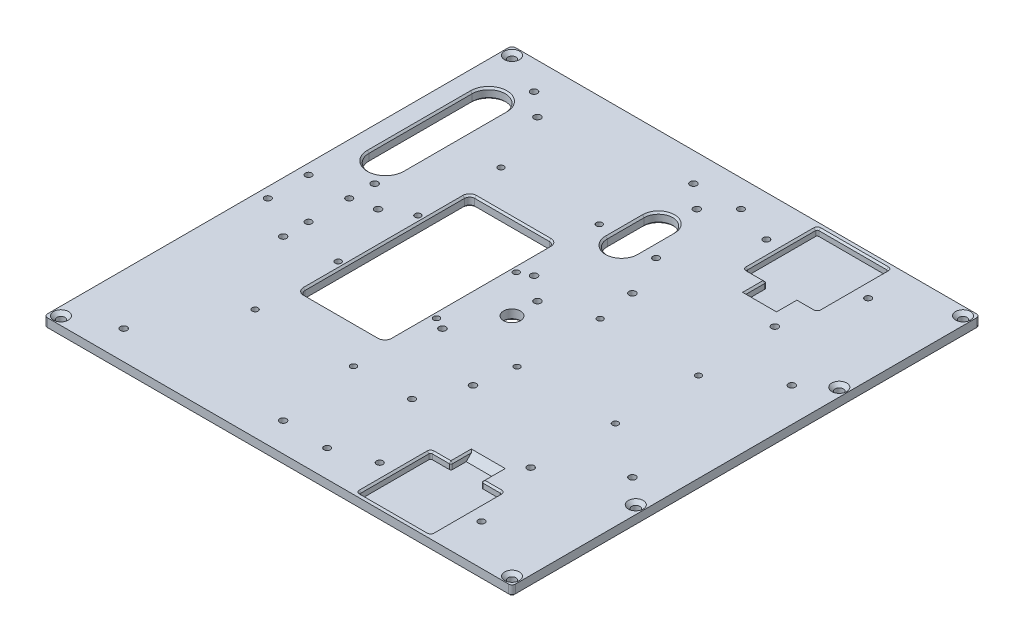
from build123d import *

# Parameters (mm, degrees)
SKETCH_1_W              = 276
SKETCH_1_H              = 276
EXTRUDE_1_DEPTH         = 6
FILLET_1_R              = 2
SKETCH_2_R              = 2.4
CUT_EXTRUDE_1_DEPTH     = 6
SKETCH_10_R             = 1.9
SKETCH_10_R_2           = 2
CUT_EXTRUDE_2259_DEPTH  = 7
SKETCH_4_R              = 2
CUT_EXTRUDE_94_94_DEPTH = 6
SKETCH_8_R              = 1.75
RPI4_DEPTH              = 6
SKETCH_6_R              = 5
SKETCH_6_W              = 50
SKETCH_6_H              = 100
CUT_EXTRUDE_5_DEPTH     = 6
CUT_EXTRUDE_14_DEPTH    = 4
CHAMFER_1_SIZE          = 4
SKETCH_12_R             = 1.9
CUT_EXTRUDE_15_DEPTH    = 196.253681143
FILLET_2_R              = 1
FILLET_3_R              = 3
CHAMFER_2_SIZE          = 2
CHAMFER_3_SIZE          = 1
CHAMFER_4_SIZE          = 1
CHAMFER_5_SIZE          = 1


with BuildPart() as part:
    # Эскиз1 → Бобышка-Вытянуть1 (new body)
    with BuildSketch(Plane(origin=(0, 0, 0), x_dir=(1, 0, 0), z_dir=(0, 1, 0))):
        Rectangle(SKETCH_1_W, SKETCH_1_H)
    extrude(amount=EXTRUDE_1_DEPTH)

    # Скругление1
    fillet_1_edges = [part.edges().sort_by_distance(p)[0] for p in [
        (138, 3, 138),
        (-138, 3, 138),
        (-138, 3, -138),
        (138, 3, -138),
    ]]
    fillet(fillet_1_edges, radius=FILLET_1_R)

    # Эскиз2 → Вырез-Вытянуть1 (cut)
    with BuildSketch(Plane(origin=(0, 6, 0), x_dir=(1, 0, 0), z_dir=(0, 1, 0))):
        with Locations(Location((133, 60, 0), (0, 0, 90))):
            Circle(SKETCH_2_R)
        with Locations(Location((133, -60, 0), (0, 0, 270))):
            Circle(SKETCH_2_R)
        with Locations(Location((133, 133, 0), (0, 0, 270))):
            Circle(SKETCH_2_R)
        with Locations(Location((133, -133, 0), (0, 0, 90))):
            Circle(SKETCH_2_R)
        with Locations(Location((-133, -133, 0), (0, 0, 270))):
            Circle(SKETCH_2_R)
        with Locations(Location((-133, 133, 0), (0, 0, 90))):
            Circle(SKETCH_2_R)
    extrude(amount=-CUT_EXTRUDE_1_DEPTH, mode=Mode.SUBTRACT)

    # Эскиз10 → Cut-Extrude 2259 (cut)
    with BuildSketch(Plane(origin=(0, 6, 0), x_dir=(1, 0, 0), z_dir=(0, 1, 0))):
        with Locations(Location((13, 122, 0), (0, 0, 270))):
            Circle(SKETCH_10_R)
        with Locations(Location((13, 72, 0), (0, 0, 90))):
            Circle(SKETCH_10_R)
        with Locations(Location((83, 72, 0), (0, 0, 270))):
            Circle(SKETCH_10_R_2)
        with Locations(Location((-132, 12, 0), (0, 0, 270))):
            Circle(SKETCH_10_R)
        with Locations(Location((-108, 12, 0), (0, 0, 270))):
            Circle(SKETCH_10_R)
        with Locations(Location((-108, -12, 0), (0, 0, 270))):
            Circle(SKETCH_10_R)
        with Locations(Location((-132, -12, 0), (0, 0, 270))):
            Circle(SKETCH_10_R)
        with Locations(Location((83, -72, 0), (0, 0, 90))):
            Circle(SKETCH_10_R_2)
        with Locations(Location((13, -72, 0), (0, 0, 270))):
            Circle(SKETCH_10_R)
        with Locations(Location((13, -122, 0), (0, 0, 90))):
            Circle(SKETCH_10_R)
    extrude(amount=-CUT_EXTRUDE_2259_DEPTH, mode=Mode.SUBTRACT)

    # Эскиз4 → 94х94 (cut)
    with BuildSketch(Plane(origin=(0, 6, 0), x_dir=(1, 0, 0), z_dir=(0, 1, 0))):
        with Locations(Location((-108, 121, 0), (0, 0, 270))):
            Circle(SKETCH_4_R)
        with Locations(Location((-14, 121, 0), (0, 0, 270))):
            Circle(SKETCH_4_R)
        with Locations(Location((-14, 27, 0), (0, 0, 90))):
            Circle(SKETCH_4_R)
        with Locations(Location((-108, 27, 0), (0, 0, 90))):
            Circle(SKETCH_4_R)
        with Locations(Location((-108, -27, 0), (0, 0, 270))):
            Circle(SKETCH_4_R)
        with Locations(Location((-14, -27, 0), (0, 0, 270))):
            Circle(SKETCH_4_R)
        with Locations(Location((-14, -121, 0), (0, 0, 90))):
            Circle(SKETCH_4_R)
        with Locations(Location((-108, -121, 0), (0, 0, 90))):
            Circle(SKETCH_4_R)
        with Locations(Location((24, 47, 0), (0, 0, 270))):
            Circle(SKETCH_4_R)
        with Locations(Location((118, 47, 0), (0, 0, 270))):
            Circle(SKETCH_4_R)
        with Locations(Location((118, -47, 0), (0, 0, 90))):
            Circle(SKETCH_4_R)
        with Locations(Location((24, -47, 0), (0, 0, 90))):
            Circle(SKETCH_4_R)
        with Locations(Location((-94, 109, 0), (0, 0, 270))):
            Circle(SKETCH_4_R)
        with Locations(Location((0, 109, 0), (0, 0, 270))):
            Circle(SKETCH_4_R)
        with Locations(Location((0, 15, 0), (0, 0, 90))):
            Circle(SKETCH_4_R)
        with Locations(Location((-94, 15, 0), (0, 0, 90))):
            Circle(SKETCH_4_R)
    extrude(amount=-CUT_EXTRUDE_94_94_DEPTH, mode=Mode.SUBTRACT)

    # Эскиз8 → RPi4 (cut)
    with BuildSketch(Plane(origin=(0, 6, 0), x_dir=(1, 0, 0), z_dir=(0, 1, 0))):
        with Locations(Location((85.46549702, 24.5, 0), (0, 0, 270))):
            Circle(SKETCH_8_R)
        with Locations(Location((27.46549702, 24.5, 0), (0, 0, 270))):
            Circle(SKETCH_8_R)
        with Locations(Location((27.46549702, -24.5, 0), (0, 0, 270))):
            Circle(SKETCH_8_R)
        with Locations(Location((85.46549702, -24.5, 0), (0, 0, 270))):
            Circle(SKETCH_8_R)
        with Locations(Location((-21, -23.5, 0), (0, 0, 270))):
            Circle(SKETCH_8_R)
        with Locations(Location((-79, -23.5, 0), (0, 0, 270))):
            Circle(SKETCH_8_R)
        with Locations(Location((-79, -72.5, 0), (0, 0, 270))):
            Circle(SKETCH_8_R)
        with Locations(Location((-21, -72.5, 0), (0, 0, 270))):
            Circle(SKETCH_8_R)
        with Locations(Location((-21, 72.5, 0), (0, 0, 90))):
            Circle(SKETCH_8_R)
        with Locations(Location((-79, 72.5, 0), (0, 0, 90))):
            Circle(SKETCH_8_R)
        with Locations(Location((-79, 23.5, 0), (0, 0, 90))):
            Circle(SKETCH_8_R)
        with Locations(Location((-21, 23.5, 0), (0, 0, 90))):
            Circle(SKETCH_8_R)
    extrude(amount=-RPI4_DEPTH, mode=Mode.SUBTRACT)

    # Эскиз6 → Вырез-Вытянуть5 (cut)
    with BuildSketch(Plane(origin=(0, 6, 0), x_dir=(1, 0, 0), z_dir=(0, 1, 0))):
        with Locations(Location((0, 0, 0), (0, 0, 270))):
            Circle(SKETCH_6_R)
        with Locations((-50, 0)):
            Rectangle(SKETCH_6_W, SKETCH_6_H)
        with BuildLine():
            Line((-126.190096729, 102.7102494), (-126.190096729, 41.883099107))
            ThreePointArc((-126.190096729, 41.883099107), (-116.445845668, 32.138848046), (-106.701594607, 41.883099107))
            Line((-106.701594607, 41.883099107), (-106.701594607, 102.7102494))
            ThreePointArc((-106.701594607, 102.7102494), (-116.445845668, 112.454500461), (-126.190096729, 102.7102494))
        make_face()
        with BuildLine():
            Line((-12.165639202, 90.126388519), (-12.165639202, 68.364519506))
            ThreePointArc((-12.165639202, 68.364519506), (-3.7236664, 59.922546704), (4.718306402, 68.364519506))
            Line((4.718306402, 68.364519506), (4.718306402, 90.126388519))
            ThreePointArc((4.718306402, 90.126388519), (-3.7236664, 98.568361321), (-12.165639202, 90.126388519))
        make_face()
    extrude(amount=-CUT_EXTRUDE_5_DEPTH, mode=Mode.SUBTRACT)

    # Эскиз11 → Вырез-Вытянуть14 (cut)
    with BuildSketch(Plane(origin=(0, 6, 0), x_dir=(1, 0, 0), z_dir=(0, 1, 0))):
        Polygon((87, 135), (45, 135), (45, 93), (57, 93), (57, 84), (75, 84), (75, 93), (87, 93), align=None)
        Polygon((45, -135), (45, -93), (57, -93), (57, -84), (75, -84), (75, -93), (87, -93), (87, -135), align=None)
    extrude(amount=-CUT_EXTRUDE_14_DEPTH, mode=Mode.SUBTRACT)

    # Фаска1
    chamfer_1_edges = [part.edges().sort_by_distance(p)[0] for p in [
        (66, 6, -84),
        (66, 6, 84),
    ]]
    chamfer(chamfer_1_edges, length=CHAMFER_1_SIZE - 0.0001)  # a hair under: the kernel refuses the full size

    # Эскиз12 → Вырез-Вытянуть15 (cut, through all)
    with BuildSketch(Plane(origin=(0, 6, 0), x_dir=(1, 0, 0), z_dir=(0, 1, 0))):
        with Locations(Location((96, 114, 0), (0, 0, 270))):
            Circle(SKETCH_12_R)
        with Locations(Location((36, 114, 0), (0, 0, 90))):
            Circle(SKETCH_12_R)
        with Locations(Location((96, -114, 0), (0, 0, 90))):
            Circle(SKETCH_12_R)
        with Locations(Location((36, -114, 0), (0, 0, 270))):
            Circle(SKETCH_12_R)
    extrude(amount=-CUT_EXTRUDE_15_DEPTH, mode=Mode.SUBTRACT)

    # Скругление2
    fillet_2_edges = [part.edges().sort_by_distance(p)[0] for p in [
        (57, 4, -93),
        (45, 4, -93),
        (45, 4, -135),
        (87, 4, -135),
        (87, 4, -93),
        (75, 4, -93),
        (87, 4, 135),
        (45, 4, 135),
        (45, 4, 93),
        (57, 4, 93),
        (75, 4, 93),
        (87, 4, 93),
    ]]
    fillet(fillet_2_edges, radius=FILLET_2_R)

    # Скругление3
    fillet_3_edges = [part.edges().sort_by_distance(p)[0] for p in [
        (-25, 3, 50),
        (-75, 3, 50),
        (-75, 3, -50),
        (-25, 3, -50),
    ]]
    fillet(fillet_3_edges, radius=FILLET_3_R)

    # Фаска2
    chamfer_2_edges = [part.edges().sort_by_distance(p)[0] for p in [
        (133, 6, 57.6),
        (133, 6, -135.4),
        (-133, 6, 130.6),
        (133, 6, 135.4),
        (-133, 6, -130.6),
        (133, 6, -57.6),
    ]]
    chamfer(chamfer_2_edges, length=CHAMFER_2_SIZE)

    # Фаска3
    chamfer_3_edges = [part.edges().sort_by_distance(p)[0] for p in [
        (13, 0, 123.9),
        (-14, 0, 25),
        (-14, 0, 123),
        (-108, 0, 123),
        (24, 0, -49),
        (138, 0, 0),
        (-108, 0, 25),
        (-108, 0, -25),
        (-14, 0, -25),
        (-14, 0, -123),
        (-94, 0, -13),
        (0, 0, -13),
        (0, 0, -111),
        (-94, 0, -111),
        (24, 0, 49),
        (118, 0, 49),
        (118, 0, -49),
        (-108, 0, -123),
        (0, 0, 138),
        (-138, 0, 0),
        (0, 0, -138),
        (137.414213562, 0, -137.414213562),
        (-137.414213562, 0, -137.414213562),
        (-137.414213562, 0, 137.414213562),
        (137.414213562, 0, 137.414213562),
        (-21, 0, -70.75),
        (-21, 0, 70.75),
        (-79, 0, 70.75),
        (-79, 0, 21.75),
        (27.46549702, 0, -26.25),
        (27.46549702, 0, 22.75),
        (85.46549702, 0, 22.75),
        (-21, 0, 21.75),
        (-79, 0, -70.75),
        (-79, 0, -21.75),
        (-21, 0, -21.75),
        (85.46549702, 0, -26.25),
        (-126.190096729, 0, -72.296674253),
        (-116.445845668, 0, -32.138848046),
        (-116.445845668, 0, -112.454500461),
        (-106.701594607, 0, -72.296674253),
        (0, 0, -5),
        (-12.165639202, 0, -79.245454013),
        (-3.7236664, 0, -59.922546704),
        (-3.7236664, 0, -98.568361321),
        (4.718306402, 0, -79.245454013),
        (36, 0, -112.1),
        (96, 0, 115.9),
        (36, 0, 112.1),
        (96, 0, -115.9),
        (-25, 0, 0),
        (-50, 0, 50),
        (-75, 0, 0),
        (-50, 0, -50),
        (-25.878679656, 0, 49.121320344),
        (-74.121320344, 0, 49.121320344),
        (-74.121320344, 0, -49.121320344),
        (133, 0, 57.6),
        (-25.878679656, 0, -49.121320344),
        (133, 0, -135.4),
        (-133, 0, 130.6),
        (133, 0, 135.4),
        (-133, 0, -130.6),
        (133, 0, -57.6),
        (13, 0, -123.9),
        (-132, 0, 10.1),
        (13, 0, -70.1),
        (83, 0, -74),
        (83, 0, 74),
        (13, 0, 70.1),
        (-108, 0, 10.1),
        (-108, 0, -13.9),
        (-132, 0, -13.9),
    ]]
    chamfer(chamfer_3_edges, length=CHAMFER_3_SIZE)

    # Фаска4
    chamfer_4_edges = [part.edges().sort_by_distance(p)[0] for p in [
        (75, 6, -86.00005),
        (57, 6, 86.00005),
        (66, 6, -135),
        (87, 6, -114),
        (45, 6, -114),
        (51, 6, -93),
        (57, 6, -86.00005),
        (81, 6, -93),
        (75, 6, 86.00005),
        (81, 6, 93),
        (87, 6, 114),
        (66, 6, 135),
        (45, 6, 114),
        (51, 6, 93),
        (75.292893219, 6, 92.707106781),
        (56.707106781, 6, 92.707106781),
        (75.292893219, 6, -92.707106781),
        (56.707106781, 6, -92.707106781),
        (86.707106781, 6, -134.707106781),
        (45.292893219, 6, -134.707106781),
        (45.292893219, 6, -93.292893219),
        (86.707106781, 6, -93.292893219),
        (86.707106781, 6, 134.707106781),
        (45.292893219, 6, 134.707106781),
        (45.292893219, 6, 93.292893219),
        (86.707106781, 6, 93.292893219),
    ]]
    chamfer(chamfer_4_edges, length=CHAMFER_4_SIZE - 0.0001)  # a hair under: the kernel refuses the full size

    # Фаска5
    chamfer_5_edges = [part.edges().sort_by_distance(p)[0] for p in [
        (-116.445845668, 6, -32.138848046),
        (-116.445845668, 6, -112.454500461),
        (-106.701594607, 6, -72.296674253),
        (-126.190096729, 6, -72.296674253),
        (-3.7236664, 6, -59.922546704),
        (-3.7236664, 6, -98.568361321),
        (4.718306402, 6, -79.245454013),
        (-12.165639202, 6, -79.245454013),
        (-25, 6, 0),
        (-50, 6, 50),
        (-75, 6, 0),
        (-50, 6, -50),
        (-25.878679656, 6, 49.121320344),
        (-74.121320344, 6, 49.121320344),
        (-74.121320344, 6, -49.121320344),
        (-25.878679656, 6, -49.121320344),
    ]]
    chamfer(chamfer_5_edges, length=CHAMFER_5_SIZE)


solid = part.part
